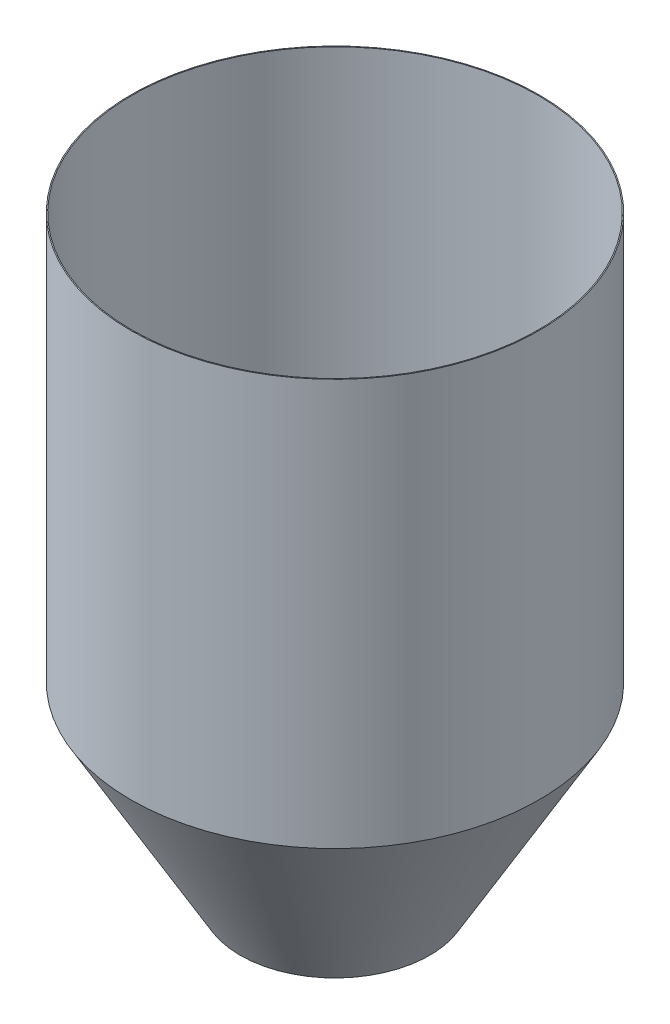
from build123d import *

# Parameters (mm, degrees)
SKETCH1_R           = 255.21412
SKETCH1_R_2         = 254
BOSS_EXTRUDE1_DEPTH = 508


with BuildPart() as part:
    # Sketch1 → Boss-Extrude1 (new body)
    with BuildSketch(Plane(origin=(0, 0, 0), x_dir=(1, 0, 0), z_dir=(0, 1, 0))):
        Circle(SKETCH1_R)
        Circle(SKETCH1_R_2, mode=Mode.SUBTRACT)
    extrude(amount=BOSS_EXTRUDE1_DEPTH)

    # Sketch2 → Revolve1 (revolve)
    with BuildSketch(Plane.XY):
        Polygon((254, 0), (117.317574699, -236.740905122), (118.531694699, -236.740905122), (255.21412, 0), align=None)
    revolve(axis=Axis((0, -439.940905122, 0), (0, 1, 0)))


solid = part.part
